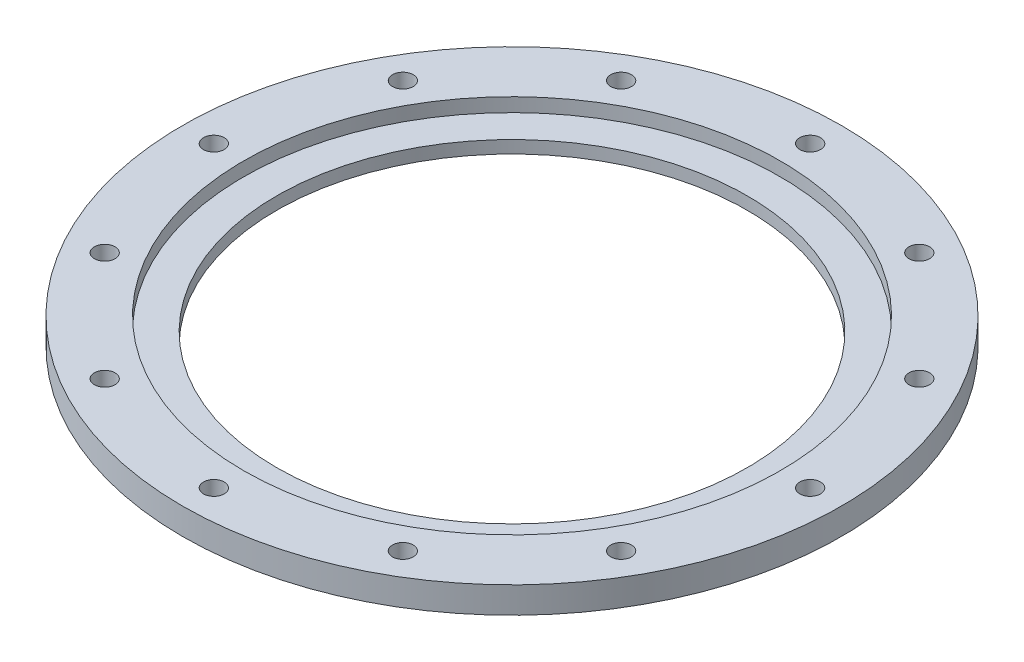
from build123d import *

# Parameters (mm, degrees)
SKETCH1_R           = 52.5
SKETCH1_R_2         = 37.5
BOSS_EXTRUDE1_DEPTH = 2
SKETCH2_R           = 52.5
SKETCH2_R_2         = 42.75
BOSS_EXTRUDE2_DEPTH = 2.2
SKETCH3_R           = 1.65
CUT_EXTRUDE1_DEPTH  = 75.36491108
CIRPATTERN1_COUNT   = 12


with BuildPart() as part:
    # Sketch1 → Boss-Extrude1 (new body)
    with BuildSketch(Plane(origin=(0, 0, 0), x_dir=(1, 0, 0), z_dir=(0, 1, 0))):
        Circle(SKETCH1_R)
        Circle(SKETCH1_R_2, mode=Mode.SUBTRACT)
    extrude(amount=BOSS_EXTRUDE1_DEPTH)

    # Sketch2 → Boss-Extrude2 (add)
    with BuildSketch(Plane(origin=(0, 2, 0), x_dir=(1, 0, 0), z_dir=(0, 1, 0))):
        Circle(SKETCH2_R)
        Circle(SKETCH2_R_2, mode=Mode.SUBTRACT)
    extrude(amount=BOSS_EXTRUDE2_DEPTH)

    # Sketch3 → Cut-Extrude1 (cut, through all)
    with BuildSketch(Plane.XZ):
        with Locations((47.5, 0)):
            Circle(SKETCH3_R)
    cut_extrude1 = extrude(amount=-CUT_EXTRUDE1_DEPTH, mode=Mode.SUBTRACT)

    # CirPattern1: Cut-Extrude1 ×12 about axis
    cirpattern1_axis = Axis((0, 0, 0), (0, 1, 0))
    for i in range(1, CIRPATTERN1_COUNT):
        add(cut_extrude1.rotate(cirpattern1_axis, i * 360 / CIRPATTERN1_COUNT), mode=Mode.SUBTRACT)


solid = part.part
